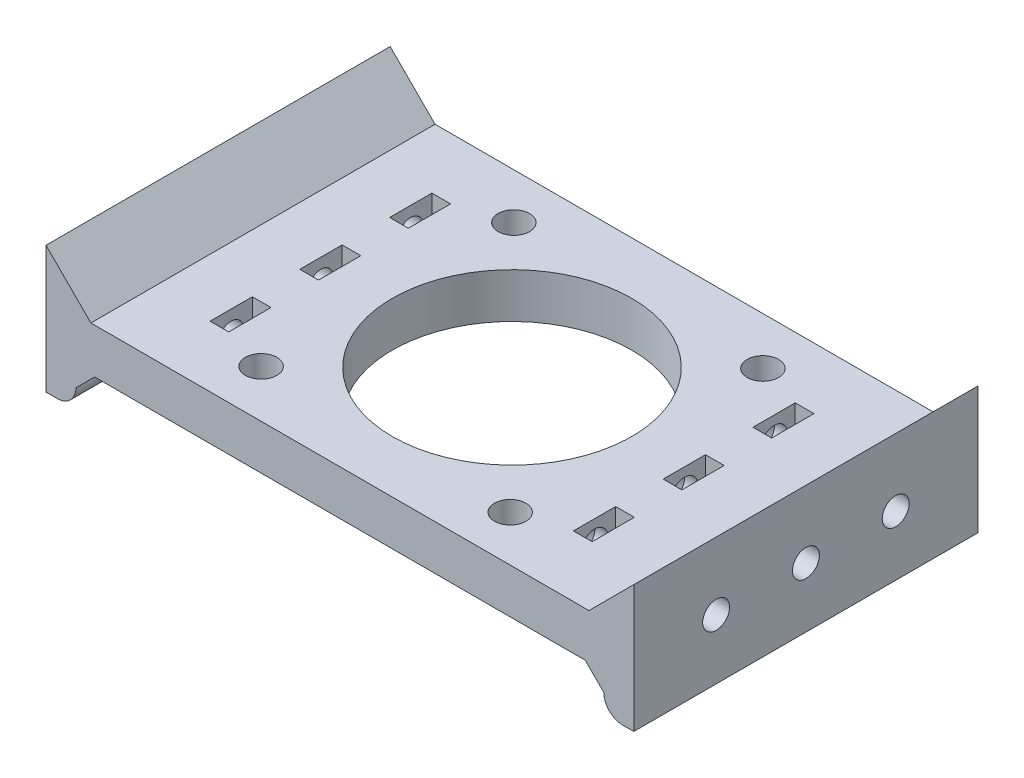
from build123d import *

# Parameters (mm, degrees)
SKETCH1_W                                           = 92.56
SKETCH1_H                                           = 46
BOSS_EXTRUDE1_DEPTH                                 = 6
SKETCH2_W                                           = 7
SKETCH2_H                                           = 46
BOSS_EXTRUDE2_DEPTH                                 = 54
SKETCH3_R                                           = 16
CUT_EXTRUDE1_DEPTH                                  = 120.512985069
SKETCH4_R                                           = 16
CUT_EXTRUDE2_DEPTH                                  = 117.616266447
F_4_2_4_2_DIAMETER_HOLE1_D                          = 4.2
F_4_2_4_2_DIAMETER_HOLE2_D                          = 4.2
CHAMFER1_SIZE                                       = 3.5
CHAMFER2_SIZE                                       = 6
BOSS_EXTRUDE3_DEPTH                                 = 46
FILLET1_R                                           = 2.5
CHAMFER3_SIZE                                       = 2.5
FILLET2_R                                           = 2.5
CSK_FOR_M3_COUNTERSUNK_FLAT_HEAD_SCREW1_D           = 3.2
CSK_FOR_M3_COUNTERSUNK_FLAT_HEAD_SCREW1_DEPTH       = 30
CSK_FOR_M3_COUNTERSUNK_FLAT_HEAD_SCREW1_CSINK_D     = 6.3
CSK_FOR_M3_COUNTERSUNK_FLAT_HEAD_SCREW1_CSINK_ANGLE = 90
CSK_FOR_M3_COUNTERSUNK_FLAT_HEAD_SCREW1_TIP         = 0.96137699
CSK_FOR_M3_COUNTERSUNK_FLAT_HEAD_SCREW2_D           = 3.6
CSK_FOR_M3_COUNTERSUNK_FLAT_HEAD_SCREW2_DEPTH       = 30
CSK_FOR_M3_COUNTERSUNK_FLAT_HEAD_SCREW2_CSINK_D     = 6.3
CSK_FOR_M3_COUNTERSUNK_FLAT_HEAD_SCREW2_CSINK_ANGLE = 90
CSK_FOR_M3_COUNTERSUNK_FLAT_HEAD_SCREW2_TIP         = 1.081549114
SKETCH18_W                                          = 2.5
SKETCH18_H                                          = 5.65
CUT_EXTRUDE4_DEPTH                                  = 121.623188484


with BuildPart() as part:
    # Sketch1 → Boss-Extrude1 (new body)
    with BuildSketch(Plane(origin=(0, 0, 0), x_dir=(1, 0, 0), z_dir=(0, 1, 0))):
        with Locations((46.28, 23)):
            Rectangle(SKETCH1_W, SKETCH1_H)
    extrude(amount=BOSS_EXTRUDE1_DEPTH)

    # Sketch2 → Boss-Extrude2 (add)
    with BuildSketch(Plane(origin=(0, 6, 0), x_dir=(1, 0, 0), z_dir=(0, 1, 0))):
        with Locations((89.06, 23)):
            Rectangle(SKETCH2_W, SKETCH2_H)
        with Locations((3.5, 23)):
            Rectangle(SKETCH2_W, SKETCH2_H)
    extrude(amount=BOSS_EXTRUDE2_DEPTH)

    # Sketch3 → Cut-Extrude1 (cut, through all)
    with BuildSketch(Plane(origin=(92.56, 0, 0), x_dir=(0, 0, -1), z_dir=(1, 0, 0))):
        with Locations((23, 37)):
            Circle(SKETCH3_R)
    extrude(amount=-CUT_EXTRUDE1_DEPTH, mode=Mode.SUBTRACT)

    # Sketch4 → Cut-Extrude2 (cut, through all)
    with BuildSketch(Plane(origin=(0, 6, 0), x_dir=(1, 0, 0), z_dir=(0, 1, 0))):
        with Locations(Location((46.28, 23, 0), (0, 0, 270))):
            Circle(SKETCH4_R)
    extrude(amount=-CUT_EXTRUDE2_DEPTH, mode=Mode.SUBTRACT)

    # Ø4.2 (4.2) Diameter Hole1 (through all)
    with Locations(Plane(origin=(0, 0, 0), x_dir=(-1, 0, 0), z_dir=(0, -1, 0))):
        with Locations((-63.165621688, 39.642079068), (-29.637920932, 39.885621688), (-29.394378312, 6.357920932), (-62.922079068, 6.114378312)):
            Hole(F_4_2_4_2_DIAMETER_HOLE1_D / 2)

    # Ø4.2 (4.2) Diameter Hole2 (through all)
    with Locations(Plane.ZY):
        with Locations((-39.885621688, 53.642079068), (-6.357920932, 53.885621688), (-6.114378312, 20.357920932), (-39.642079068, 20.114378312)):
            Hole(F_4_2_4_2_DIAMETER_HOLE2_D / 2)

    # Chamfer1
    chamfer1_edges = [part.edges().sort_by_distance(p)[0] for p in [
        (89.06, 60, -46),
        (89.06, 60, 0),
        (3.5, 60, 0),
        (3.5, 60, -46),
    ]]
    chamfer(chamfer1_edges, length=CHAMFER1_SIZE)

    # Chamfer2
    chamfer2_edges = [part.edges().sort_by_distance(p)[0] for p in [
        (85.56, 6, -23),
        (7, 6, -23),
    ]]
    chamfer(chamfer2_edges, length=CHAMFER2_SIZE)

    # Sketch10 → Boss-Extrude3 (add)
    with BuildSketch(Plane(origin=(0, 0, -46), x_dir=(-1, 0, 0), z_dir=(0, 0, -1))):
        Polygon((0, 11), (5, 11), (5, -5), (-11, -5), (-11, 0), (0, 0), align=None)
        Polygon((-81.56, 0), (-92.56, 0), (-92.56, 11), (-97.56, 11), (-97.56, -5), (-81.56, -5), align=None)
    extrude(amount=-BOSS_EXTRUDE3_DEPTH)

    # Fillet1
    fillet1_edges = [part.edges().sort_by_distance(p)[0] for p in [
        (-5, 11, -23),
        (11, -5, -23),
        (81.56, -5, -23),
        (97.56, 11, -23),
    ]]
    fillet(fillet1_edges, radius=FILLET1_R)

    # Chamfer3
    chamfer3_edges = [part.edges().sort_by_distance(p)[0] for p in [
        (92.56, 11, -23),
        (81.56, 0, -23),
        (11, 0, -23),
        (0, 11, -23),
    ]]
    chamfer(chamfer3_edges, length=CHAMFER3_SIZE - 0.0001)  # a hair under: the kernel refuses the full size

    # Fillet2
    fillet2_edges = [part.edges().sort_by_distance(p)[0] for p in [
        (-5, -5, -23),
        (97.56, -5, -23),
    ]]
    fillet(fillet2_edges, radius=FILLET2_R)

    # CSK for M3 Countersunk Flat Head Screw1
    with Locations(Plane.ZY.offset(5)):
        with Locations((-11, 3), (-23, 3), (-35, 3)):
            CounterSinkHole(CSK_FOR_M3_COUNTERSUNK_FLAT_HEAD_SCREW1_D / 2, CSK_FOR_M3_COUNTERSUNK_FLAT_HEAD_SCREW1_CSINK_D / 2, depth=CSK_FOR_M3_COUNTERSUNK_FLAT_HEAD_SCREW1_DEPTH, counter_sink_angle=CSK_FOR_M3_COUNTERSUNK_FLAT_HEAD_SCREW1_CSINK_ANGLE)
            with Locations((0, 0, -(CSK_FOR_M3_COUNTERSUNK_FLAT_HEAD_SCREW1_DEPTH + CSK_FOR_M3_COUNTERSUNK_FLAT_HEAD_SCREW1_TIP / 2))):  # 118° drill point
                Cone(0, CSK_FOR_M3_COUNTERSUNK_FLAT_HEAD_SCREW1_D / 2, CSK_FOR_M3_COUNTERSUNK_FLAT_HEAD_SCREW1_TIP, mode=Mode.SUBTRACT)

    # CSK for M3 Countersunk Flat Head Screw2
    with Locations(Plane(origin=(97.56, 0, 0), x_dir=(0, 0, -1), z_dir=(1, 0, 0))):
        with Locations((11, 3), (23, 3), (35, 3)):
            CounterSinkHole(CSK_FOR_M3_COUNTERSUNK_FLAT_HEAD_SCREW2_D / 2, CSK_FOR_M3_COUNTERSUNK_FLAT_HEAD_SCREW2_CSINK_D / 2, depth=CSK_FOR_M3_COUNTERSUNK_FLAT_HEAD_SCREW2_DEPTH, counter_sink_angle=CSK_FOR_M3_COUNTERSUNK_FLAT_HEAD_SCREW2_CSINK_ANGLE)
            with Locations((0, 0, -(CSK_FOR_M3_COUNTERSUNK_FLAT_HEAD_SCREW2_DEPTH + CSK_FOR_M3_COUNTERSUNK_FLAT_HEAD_SCREW2_TIP / 2))):  # 118° drill point
                Cone(0, CSK_FOR_M3_COUNTERSUNK_FLAT_HEAD_SCREW2_D / 2, CSK_FOR_M3_COUNTERSUNK_FLAT_HEAD_SCREW2_TIP, mode=Mode.SUBTRACT)

    # Sketch18 → Cut-Extrude4 (cut, through all)
    with BuildSketch(Plane(origin=(0, 6, 0), x_dir=(1, 0, 0), z_dir=(0, 1, 0))):
        with Locations((22, 23)):
            Rectangle(SKETCH18_W, SKETCH18_H)
        with Locations((22, 35)):
            Rectangle(SKETCH18_W, SKETCH18_H)
        with Locations((22, 11)):
            Rectangle(SKETCH18_W, SKETCH18_H)
    cut_extrude4 = extrude(amount=-CUT_EXTRUDE4_DEPTH, mode=Mode.SUBTRACT)

    # Mirror1: Cut-Extrude4 across plane
    add(cut_extrude4.mirror(Plane.ZY.offset(-46.28)), mode=Mode.SUBTRACT)

    # SurfaceCut1
    split(bisect_by=Plane(origin=(7, 0, 0), x_dir=(0, 0, -1), z_dir=(1, 0, 0)), keep=Keep.TOP)

    # SurfaceCut2
    split(bisect_by=Plane.ZY.offset(-85.56), keep=Keep.TOP)


solid = part.part
